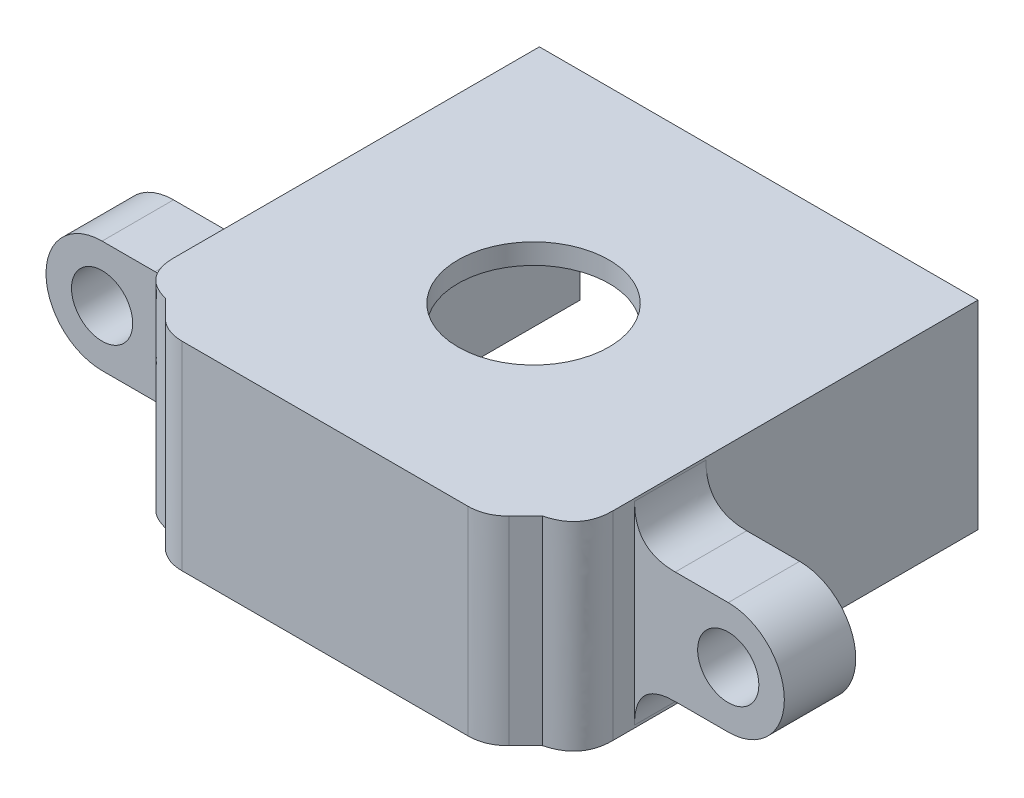
from build123d import *

# Parameters (mm, degrees)
SALIENTE_EXTRUIR1_DEPTH    = 37.897155233
SALIENTE_EXTRUIR1_START    = 48.902844667
SALIENTE_EXTRUIR1_2_DEPTH  = 3.298155333
SALIENTE_EXTRUIR1_START_2  = 18.604709337
SALIENTE_EXTRUIR1_3_DEPTH  = 7.749092069
SALIENTE_EXTRUIR1_START_3  = 23.025896305
SALIENTE_EXTRUIR1_4_DEPTH  = 2.885270101
SALIENTE_EXTRUIR1_START_4  = 37.897155263
SALIENTE_EXTRUIR1_5_DEPTH  = 11.005689404
SALIENTE_EXTRUIR1_6_DEPTH  = 37.897155233
SALIENTE_EXTRUIR1_7_DEPTH  = 3.298155333
SALIENTE_EXTRUIR1_8_DEPTH  = 7.749092069
SALIENTE_EXTRUIR1_9_DEPTH  = 2.885270101
SALIENTE_EXTRUIR1_START_5  = 37.897155323
SALIENTE_EXTRUIR1_10_DEPTH = 11.005689344
CROQUIS2_W                 = 18.498184139
CROQUIS2_H                 = 19.837567485
CROQUIS2_R                 = 3.7
SALIENTE_EXTRUIR2_DEPTH    = 1
SALIENTE_EXTRUIR3_START    = -9.749092
SALIENTE_EXTRUIR3_DEPTH    = 9.749092
CROQUIS5_W                 = 18.498184139
CROQUIS5_H                 = 32.363432515
CORTAR_EXTRUIR1_DEPTH      = 10
CROQUIS6_W                 = 19.837567485
CROQUIS6_H                 = 9.749092069
SALIENTE_EXTRUIR4_DEPTH    = 2
CROQUIS7_W                 = 19.837567485
CROQUIS7_H                 = 9.749092069
SALIENTE_EXTRUIR5_DEPTH    = 2
CROQUIS9_R                 = 1.5
SALIENTE_EXTRUIR6_DEPTH    = 3.5
REDONDEO1_START            = 45.701
REDONDEO1_DEPTH            = 3.5
REDONDEO1_START_2          = 18
REDONDEO1_2_DEPTH          = 11


with BuildPart() as part:
    # Saliente-Extruir1: read off the stored shape, not the designer's step
    # Saliente-Extruir1 outline → Saliente-Extruir1 (new body)
    with BuildSketch(Plane.XY):
        with BuildLine():
            Line((-1.827909615, 26.353801406), (-1.827909615, 25.911166406))
            ThreePointArc((-1.827909615, 25.911166406), (-2.534740392, 25.726142632), (-3.060263357, 25.218531406))
            Line((-3.060263357, 25.218531406), (-3.709782409, 24.843531406))
            Line((-3.709782409, 24.843531406), (-3.709782409, 24.093531406))
            Line((-3.709782409, 24.093531406), (-3.060263357, 23.718531406))
            ThreePointArc((-3.060263357, 23.718531406), (-2.534740392, 23.210920179), (-1.827909615, 23.025896405))
            Line((-1.827909615, 23.025896405), (-1.827909615, 18.604709337))
            Line((-1.827909615, 18.604709337), (-1.327909615, 18.604709337))
            Line((-1.327909615, 18.604709337), (-1.327909615, 26.353801406))
            Line((-1.327909615, 26.353801406), (-1.827909615, 26.353801406))
        make_face()
    extrude(amount=SALIENTE_EXTRUIR1_DEPTH)

    # Saliente-Extruir1 2 outline → Saliente-Extruir1 2 (add)
    with BuildSketch(Plane.XY.offset(SALIENTE_EXTRUIR1_START)):
        with BuildLine():
            Line((-1.827909615, 26.353801406), (-1.827909615, 25.911166406))
            ThreePointArc((-1.827909615, 25.911166406), (-2.534740392, 25.726142632), (-3.060263357, 25.218531406))
            Line((-3.060263357, 25.218531406), (-3.709782409, 24.843531406))
            Line((-3.709782409, 24.843531406), (-3.709782409, 24.093531406))
            Line((-3.709782409, 24.093531406), (-3.060263357, 23.718531406))
            ThreePointArc((-3.060263357, 23.718531406), (-2.534740392, 23.210920179), (-1.827909615, 23.025896405))
            Line((-1.827909615, 23.025896405), (-1.827909615, 18.604709337))
            Line((-1.827909615, 18.604709337), (-1.327909615, 18.604709337))
            Line((-1.327909615, 18.604709337), (-1.327909615, 26.353801406))
            Line((-1.327909615, 26.353801406), (-1.827909615, 26.353801406))
        make_face()
    extrude(amount=SALIENTE_EXTRUIR1_2_DEPTH)

    # Saliente-Extruir1 3 outline → Saliente-Extruir1 3 (add)
    with BuildSketch(Plane(origin=(0, 0, 0), x_dir=(1, 0, 0), z_dir=(0, 1, 0)).offset(SALIENTE_EXTRUIR1_START_2)):
        with BuildLine():
            Line((-1.827909615, -37.897155233), (-1.827909616, -42.454807977))
            ThreePointArc((-1.827909616, -42.454807977), (-1.777001685, -43.4), (-1.827909616, -44.345192023))
            Line((-1.827909616, -44.345192023), (-1.827909615, -48.902844667))
            Line((-1.827909615, -48.902844667), (-1.327909615, -48.902844667))
            Line((-1.327909615, -48.902844667), (-1.327909615, -37.897155233))
            Line((-1.327909615, -37.897155233), (-1.827909615, -37.897155233))
        make_face()
    extrude(amount=SALIENTE_EXTRUIR1_3_DEPTH)

    # Saliente-Extruir1 4 outline → Saliente-Extruir1 4 (add)
    with BuildSketch(Plane(origin=(0, 0, 0), x_dir=(1, 0, 0), z_dir=(0, 1, 0)).offset(SALIENTE_EXTRUIR1_START_3)):
        with BuildLine():
            ThreePointArc((-3.709782409, -37.897155333), (-2.44310075, -40.041480149), (-1.827909616, -42.454807977))
            Line((-1.827909616, -42.454807977), (-1.827909615, -37.897155233))
            Line((-1.827909615, -37.897155233), (-3.709782409, -37.897155333))
        make_face()
        with BuildLine():
            Line((-1.827909615, -48.902844667), (-1.827909616, -44.345192023))
            ThreePointArc((-1.827909616, -44.345192023), (-2.44310075, -46.758519851), (-3.709782409, -48.902844667))
            Line((-3.709782409, -48.902844667), (-1.827909615, -48.902844667))
        make_face()
    extrude(amount=SALIENTE_EXTRUIR1_4_DEPTH)

    # Saliente-Extruir1 5 outline → Saliente-Extruir1 5 (cut)
    with BuildSketch(Plane.XY.offset(SALIENTE_EXTRUIR1_START_4)):
        with BuildLine():
            ThreePointArc((-3.060263357, 25.218531406), (-2.534740392, 25.726142632), (-1.827909615, 25.911166406))
            Line((-1.827909615, 25.911166406), (-3.709782409, 25.911166406))
            Line((-3.709782409, 25.911166406), (-3.709782409, 24.843531406))
            Line((-3.709782409, 24.843531406), (-3.060263357, 25.218531406))
        make_face()
        with BuildLine():
            Line((-3.709782409, 23.025896305), (-1.827909615, 23.025896405))
            ThreePointArc((-1.827909615, 23.025896405), (-2.534740392, 23.210920179), (-3.060263357, 23.718531406))
            Line((-3.060263357, 23.718531406), (-3.709782409, 24.093531406))
            Line((-3.709782409, 24.093531406), (-3.709782409, 23.025896305))
        make_face()
    extrude(amount=SALIENTE_EXTRUIR1_5_DEPTH, mode=Mode.SUBTRACT)



with BuildPart() as body_2:
    # Saliente-Extruir1 6 outline → Saliente-Extruir1 6 (new body)
    with BuildSketch(Plane.XY):
        with BuildLine():
            Line((-19.326093754, 18.604709337), (-19.326093754, 23.025896405))
            ThreePointArc((-19.326093754, 23.025896405), (-18.619262977, 23.210920179), (-18.093740013, 23.718531406))
            Line((-18.093740013, 23.718531406), (-17.44422096, 24.093531406))
            Line((-17.44422096, 24.093531406), (-17.44422096, 24.843531406))
            Line((-17.44422096, 24.843531406), (-18.093740013, 25.218531406))
            ThreePointArc((-18.093740013, 25.218531406), (-18.619262978, 25.726142632), (-19.326093754, 25.911166406))
            Line((-19.326093754, 25.911166406), (-19.326093754, 26.353801406))
            Line((-19.326093754, 26.353801406), (-19.826093754, 26.353801406))
            Line((-19.826093754, 26.353801406), (-19.826093754, 18.604709337))
            Line((-19.826093754, 18.604709337), (-19.326093754, 18.604709337))
        make_face()
    extrude(amount=SALIENTE_EXTRUIR1_6_DEPTH)

    # Saliente-Extruir1 7 outline → Saliente-Extruir1 7 (add)
    with BuildSketch(Plane.XY.offset(SALIENTE_EXTRUIR1_START)):
        with BuildLine():
            Line((-19.326093754, 18.604709337), (-19.326093754, 23.025896405))
            ThreePointArc((-19.326093754, 23.025896405), (-18.619262977, 23.210920179), (-18.093740013, 23.718531406))
            Line((-18.093740013, 23.718531406), (-17.44422096, 24.093531406))
            Line((-17.44422096, 24.093531406), (-17.44422096, 24.843531406))
            Line((-17.44422096, 24.843531406), (-18.093740013, 25.218531406))
            ThreePointArc((-18.093740013, 25.218531406), (-18.619262978, 25.726142632), (-19.326093754, 25.911166406))
            Line((-19.326093754, 25.911166406), (-19.326093754, 26.353801406))
            Line((-19.326093754, 26.353801406), (-19.826093754, 26.353801406))
            Line((-19.826093754, 26.353801406), (-19.826093754, 18.604709337))
            Line((-19.826093754, 18.604709337), (-19.326093754, 18.604709337))
        make_face()
    extrude(amount=SALIENTE_EXTRUIR1_7_DEPTH)

    # Saliente-Extruir1 8 outline → Saliente-Extruir1 8 (add)
    with BuildSketch(Plane(origin=(0, 0, 0), x_dir=(1, 0, 0), z_dir=(0, 1, 0)).offset(SALIENTE_EXTRUIR1_START_2)):
        with BuildLine():
            Line((-19.326093754, -48.902844667), (-19.326093754, -44.345192023))
            ThreePointArc((-19.326093754, -44.345192023), (-19.377001685, -43.4), (-19.326093754, -42.454807977))
            Line((-19.326093754, -42.454807977), (-19.326093754, -37.897155233))
            Line((-19.326093754, -37.897155233), (-19.826093754, -37.897155233))
            Line((-19.826093754, -37.897155233), (-19.826093754, -48.902844667))
            Line((-19.826093754, -48.902844667), (-19.326093754, -48.902844667))
        make_face()
    extrude(amount=SALIENTE_EXTRUIR1_8_DEPTH)

    # Saliente-Extruir1 9 outline → Saliente-Extruir1 9 (add)
    with BuildSketch(Plane(origin=(0, 0, 0), x_dir=(1, 0, 0), z_dir=(0, 1, 0)).offset(SALIENTE_EXTRUIR1_START_3)):
        with BuildLine():
            ThreePointArc((-17.44422096, -48.902844667), (-18.710902619, -46.758519851), (-19.326093754, -44.345192023))
            Line((-19.326093754, -44.345192023), (-19.326093754, -48.902844667))
            Line((-19.326093754, -48.902844667), (-17.44422096, -48.902844667))
        make_face()
        with BuildLine():
            Line((-19.326093754, -37.897155233), (-19.326093754, -42.454807977))
            ThreePointArc((-19.326093754, -42.454807977), (-18.710902619, -40.041480149), (-17.44422096, -37.897155333))
            Line((-17.44422096, -37.897155333), (-19.326093754, -37.897155233))
        make_face()
    extrude(amount=SALIENTE_EXTRUIR1_9_DEPTH)

    # Saliente-Extruir1 10 outline → Saliente-Extruir1 10 (cut)
    with BuildSketch(Plane.XY.offset(SALIENTE_EXTRUIR1_START_5)):
        with BuildLine():
            Line((-19.326093754, 23.025896405), (-17.44422096, 23.025896305))
            Line((-17.44422096, 23.025896305), (-17.44422096, 24.093531406))
            Line((-17.44422096, 24.093531406), (-18.093740013, 23.718531406))
            ThreePointArc((-18.093740013, 23.718531406), (-18.619262977, 23.210920179), (-19.326093754, 23.025896405))
        make_face()
        with BuildLine():
            Line((-18.093740013, 25.218531406), (-17.44422096, 24.843531406))
            Line((-17.44422096, 24.843531406), (-17.44422096, 25.911166406))
            Line((-17.44422096, 25.911166406), (-19.326093754, 25.911166406))
            ThreePointArc((-19.326093754, 25.911166406), (-18.619262978, 25.726142632), (-18.093740013, 25.218531406))
        make_face()
    extrude(amount=SALIENTE_EXTRUIR1_10_DEPTH, mode=Mode.SUBTRACT)


with BuildPart() as body_3:
    # Croquis2 → Saliente-Extruir2 (new body)
    with BuildSketch(Plane(origin=(0, 27.353801406, 0), x_dir=(1, 0, 0), z_dir=(0, 1, 0))):
        with Locations((-10.577001685, -42.282216257)):
            Rectangle(CROQUIS2_W, CROQUIS2_H)
        with Locations(Location((-10.577001685, -43.4, 0), (0, 0, 270))):
            Circle(CROQUIS2_R, mode=Mode.SUBTRACT)
    extrude(amount=SALIENTE_EXTRUIR2_DEPTH)


with BuildPart() as part_1:
    add(part.part)

    add(body_2.part)  # Saliente-Extruir3 merges body 2

    add(body_3.part)  # Saliente-Extruir3 merges body 3
    # Croquis4 → Saliente-Extruir3 (add)
    with BuildSketch(Plane(origin=(0, 28.353801406, 0), x_dir=(1, 0, 0), z_dir=(0, 1, 0)).offset(SALIENTE_EXTRUIR3_START)):
        with BuildLine():
            Line((-19.377013223, -43.4), (-19.826093754, -43.4))
            Line((-19.826093754, -43.4), (-19.826093754, -52.201))
            Line((-19.826093754, -52.201), (-18.411880192, -53.615213562))
            Line((-18.411880192, -53.615213562), (-2.742123178, -53.615213562))
            Line((-2.742123178, -53.615213562), (-1.327909615, -52.201))
            Line((-1.327909615, -52.201), (-1.327909615, -43.4))
            Line((-1.327909615, -43.4), (-1.776990146, -43.4))
            ThreePointArc((-1.776990146, -43.4), (-10.577001685, -52.200011538), (-19.377013223, -43.4))
        make_face()
    extrude(amount=SALIENTE_EXTRUIR3_DEPTH)

    # Croquis5 → Cortar-Extruir1 (cut)
    with BuildSketch(Plane(origin=(0, 28.353801406, 0), x_dir=(1, 0, 0), z_dir=(0, 1, 0))):
        with Locations((-10.577001685, -16.181716257)):
            Rectangle(CROQUIS5_W, CROQUIS5_H)
    extrude(amount=-CORTAR_EXTRUIR1_DEPTH, mode=Mode.SUBTRACT)

    # Croquis6 → Saliente-Extruir4 (add)
    with BuildSketch(Plane.ZY.offset(1.827909615)):
        with Locations((42.282216257, 23.479255372)):
            Rectangle(CROQUIS6_W, CROQUIS6_H)
    extrude(amount=-SALIENTE_EXTRUIR4_DEPTH)

    # Croquis7 → Saliente-Extruir5 (add)
    with BuildSketch(Plane(origin=(-19.326093754, 0, 0), x_dir=(0, 0, -1), z_dir=(1, 0, 0))):
        with Locations((-42.282216257, 23.479255372)):
            Rectangle(CROQUIS7_W, CROQUIS7_H)
    extrude(amount=-SALIENTE_EXTRUIR5_DEPTH)

    # Croquis9 → Saliente-Extruir6 (add)
    # profile 1 of 2: a face of its own
    with BuildSketch(Plane(origin=(0, 0, 49.201), x_dir=(-1, 0, 0), z_dir=(0, 0, -1))):
        with BuildLine():
            Line((-0.172090385, 26.229255371), (-4.767620442, 26.229255371))
            ThreePointArc((-4.767620442, 26.229255371), (-7.517620442, 23.479255371), (-4.767620442, 20.729255371))
            Line((-4.767620442, 20.729255371), (-0.172090385, 20.729255371))
            Line((-0.172090385, 20.729255371), (-0.172090385, 26.229255371))
        make_face()
        with Locations(Location((-4.767620442, 23.479255371, 0), (0, 0, 270))):
            Circle(CROQUIS9_R, mode=Mode.SUBTRACT)
    # profile 2 of 2: a face of its own
    with BuildSketch(Plane(origin=(0, 0, 49.201), x_dir=(-1, 0, 0), z_dir=(0, 0, -1))):
        with BuildLine():
            Line((21.326093754, 26.229255371), (25.921623811, 26.229255371))
            ThreePointArc((25.921623811, 26.229255371), (28.671623811, 23.479255371), (25.921623811, 20.729255371))
            Line((25.921623811, 20.729255371), (21.326093754, 20.729255371))
            Line((21.326093754, 20.729255371), (21.326093754, 26.229255371))
        make_face()
        with Locations(Location((25.921623811, 23.479255371, 0), (0, 0, 90))):
            Circle(CROQUIS9_R, mode=Mode.SUBTRACT)
    extrude(amount=SALIENTE_EXTRUIR6_DEPTH)

    # Redondeo1: read off the stored shape, not the designer's step
    # Redondeo1 outline → Redondeo1 (add)
    with BuildSketch(Plane.XY.offset(REDONDEO1_START)):
        with BuildLine():
            Line((-21.326093754, 20.729255371), (-23.326093754, 20.729255371))
            add(Edge.make_bspline(
                [(-23.326093754, 20.729255371), (-21.326093754, 20.729255371), (-21.326093754, 18.729255371)],
                knots=[0, 0, 0, 1, 1, 1], degree=2))
            Line((-21.326093754, 18.729255371), (-21.326093754, 20.729255371))
        make_face()
        with BuildLine():
            Line((-23.326093754, 26.229255371), (-21.326093754, 26.229255371))
            Line((-21.326093754, 26.229255371), (-21.326093754, 28.229255371))
            add(Edge.make_bspline(
                [(-21.326093754, 28.229255371), (-21.326093754, 26.229255371), (-23.326093754, 26.229255371)],
                knots=[0, 0, 0, 1, 1, 1], degree=2))
        make_face()
        with BuildLine():
            Line((0.172090385, 20.729255371), (0.172090385, 18.729255371))
            add(Edge.make_bspline(
                [(2.172090385, 20.729255371), (0.172090385, 20.729255371), (0.172090385, 18.729255371)],
                knots=[0, 0, 0, 1, 1, 1], degree=2))
            Line((2.172090385, 20.729255371), (0.172090385, 20.729255371))
        make_face()
        with BuildLine():
            Line((0.172090385, 28.229255371), (0.172090385, 26.229255371))
            Line((0.172090385, 26.229255371), (2.172090385, 26.229255371))
            add(Edge.make_bspline(
                [(0.172090385, 28.229255371), (0.172090385, 26.229255371), (2.172090385, 26.229255371)],
                knots=[0, 0, 0, 1, 1, 1], degree=2))
        make_face()
    extrude(amount=REDONDEO1_DEPTH)

    # Redondeo1 2 outline → Redondeo1 2 (cut)
    with BuildSketch(Plane(origin=(0, 0, 0), x_dir=(1, 0, 0), z_dir=(0, 1, 0)).offset(REDONDEO1_START_2)):
        with BuildLine():
            add(Edge.make_bspline(
                [(0.172090385, -50.264508327), (0.172090385, -51.813701665), (-1.327909615, -52.201)],
                knots=[0, 0, 0, 1, 1, 1], degree=2))
            Line((-1.327909615, -52.201), (0.172090385, -52.201))
            Line((0.172090385, -52.201), (0.172090385, -50.264508327))
        make_face()
        with BuildLine():
            add(Edge.make_bspline(
                [(-3.570550302, -53.615213562), (-2.742123178, -53.615213562), (-2.15633674, -53.029427125)],
                knots=[0, 0, 0, 1, 1, 1], degree=2))
            Line((-3.570550302, -53.615213562), (-2.742123178, -53.615213562))
            Line((-2.742123178, -53.615213562), (-2.15633674, -53.029427125))
        make_face()
        with BuildLine():
            Line((-21.326093754, -52.201), (-19.826093754, -52.201))
            add(Edge.make_bspline(
                [(-19.826093754, -52.201), (-21.326093754, -51.813701665), (-21.326093754, -50.264508327)],
                knots=[0, 0, 0, 1, 1, 1], degree=2))
            Line((-21.326093754, -50.264508327), (-21.326093754, -52.201))
        make_face()
        with BuildLine():
            add(Edge.make_bspline(
                [(-18.997666629, -53.029427125), (-18.411880192, -53.615213562), (-17.583453067, -53.615213562)],
                knots=[0, 0, 0, 1, 1, 1], degree=2))
            Line((-18.997666629, -53.029427125), (-18.411880192, -53.615213562))
            Line((-18.411880192, -53.615213562), (-17.583453067, -53.615213562))
        make_face()
    extrude(amount=REDONDEO1_2_DEPTH, mode=Mode.SUBTRACT)


solid = part_1.part
